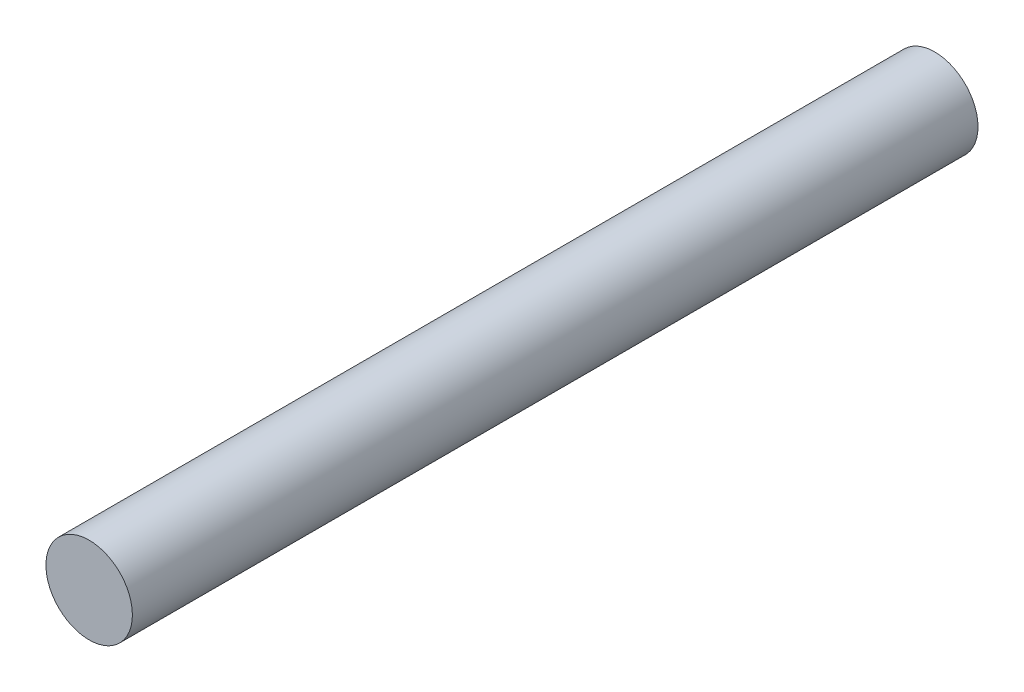
from build123d import *

# Parameters (mm, degrees)
SKETCH1_R           = 10
BOSS_EXTRUDE1_DEPTH = 195.6


with BuildPart() as part:
    # Sketch1 → Boss-Extrude1 (new body)
    with BuildSketch(Plane.XY):
        Circle(SKETCH1_R)
    extrude(amount=BOSS_EXTRUDE1_DEPTH)


solid = part.part
